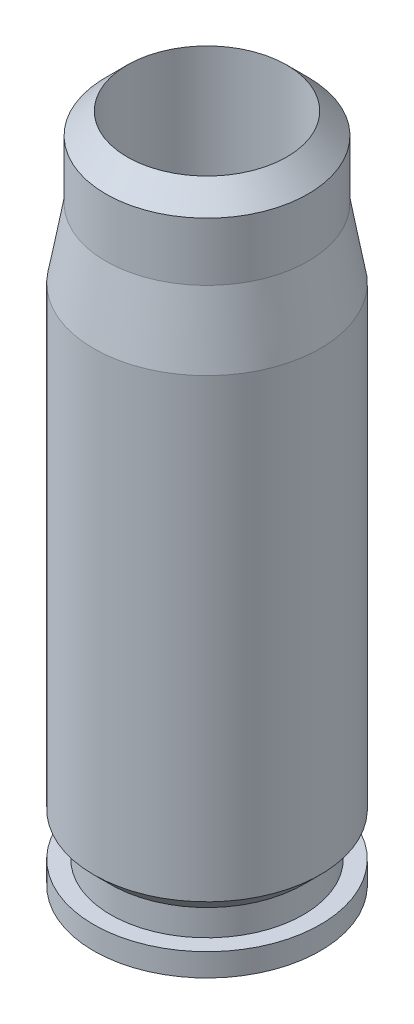
from build123d import *

# Parameters (mm, degrees)
CHAMFER_1_SIZE = 3


with BuildPart() as part:
    # 스케치3 → 회전1 (revolve)
    with BuildSketch(Plane(origin=(0, 0, 0), x_dir=(0, 0, -1), z_dir=(1, 0, 0))):
        Polygon((4.5, 0), (9.95, 0), (9.95, 2), (8.458613311, 2), (8.458613311, 4.3), (9.95, 5.791386689), (9.95, 45.791386689), (8.875, 51.888014645), (8.875, 60), (7, 60), (7, 12), (4.5, 12), align=None)
    revolve(axis=Axis((0, 0, 0), (0, 1, 0)))

    # 모따기1
    # the kernel refuses this chamfer: 3 mm, written as the material it takes off along each edge
    with BuildSketch(Plane(origin=(0, 60, 0), x_dir=(0, 0, -1), z_dir=(1, 0, 0))) as chamfer_1_piece_1:
        Polygon((8.875, -CHAMFER_1_SIZE), (8.875 - CHAMFER_1_SIZE, 0), (8.875, 0), align=None)
    revolve(axis=Axis((0, 60, 0), (0, 1, 0)), mode=Mode.SUBTRACT)


solid = part.part
